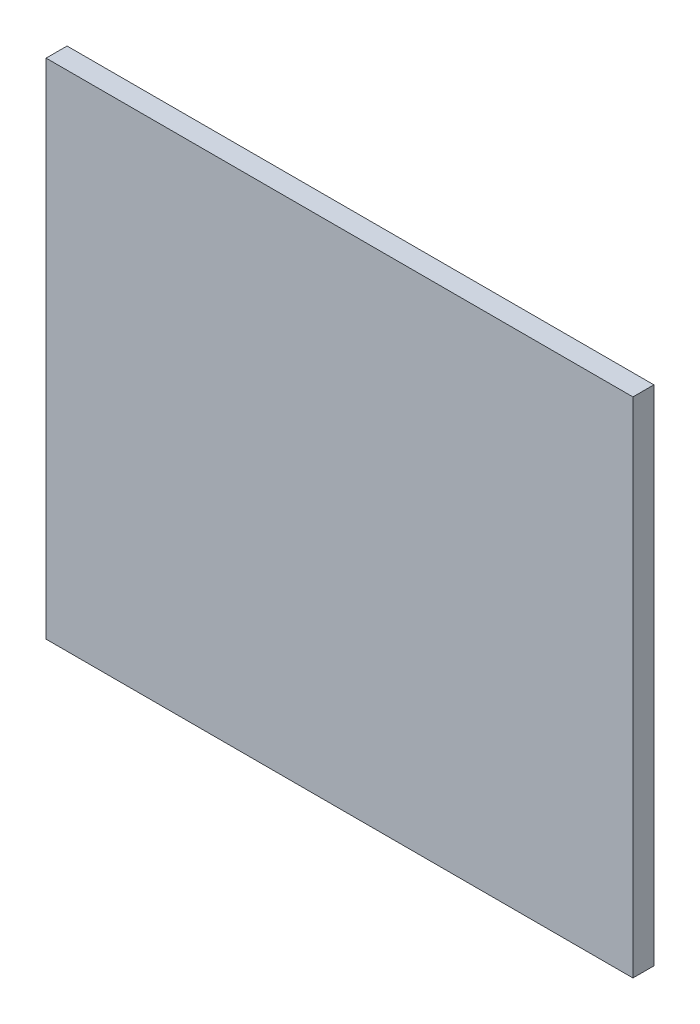
from build123d import *

# Parameters (mm, degrees)
SKETCH1_W           = 533.146
SKETCH1_H           = 457.2
BOSS_EXTRUDE1_DEPTH = 19.05


with BuildPart() as part:
    # Sketch1 → Boss-Extrude1 (new body)
    with BuildSketch(Plane.XY):
        with Locations((0, 2912.11)):
            Rectangle(SKETCH1_W, SKETCH1_H)
    extrude(amount=-BOSS_EXTRUDE1_DEPTH)


solid = part.part
